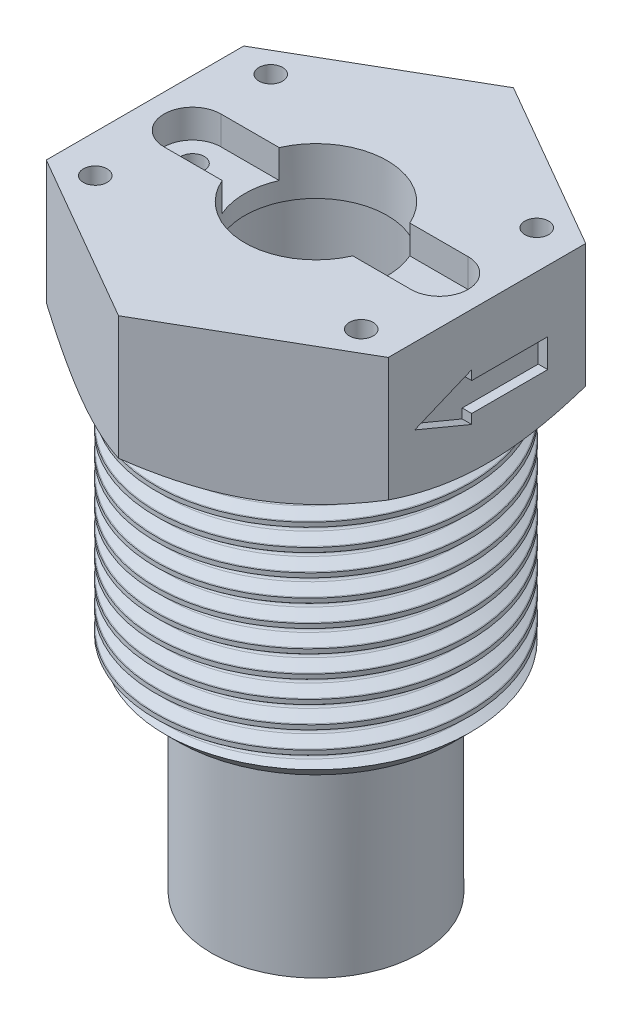
from build123d import *

# Parameters (mm, degrees)
SKETCH_1_W             = 11
SKETCH_1_H             = 65
SKETCH_8_R             = 18.027171515
CUT_EXTRUDE_8_DEPTH    = 2
SKETCH_10_R            = 9.5
CUT_EXTRUDE_10_DEPTH   = 58
SKETCH_11_R            = 7.5
CUT_EXTRUDE_11_DEPTH   = 6
SKETCH_25_R            = 9.5
EXTRUDE_4_DEPTH        = 15
WRAP_START             = -33
WRAP_1_DEPTH           = 1
SKETCH_20_R            = 16.5
SKETCH_20_R_2          = 11
EXTRUDE_3_DEPTH        = 27
CHAMFER_1_SIZE         = 2
SWEEP_2_PITCH          = 2.309
CUT_EXTRUDE_12_DEPTH   = 3
HOLE_WIZARD_M3_1_D     = 2.5
HOLE_WIZARD_M3_1_DEPTH = 10.5
HOLE_WIZARD_M3_1_TIP   = 0.751075774


with BuildPart() as part:
    # 草图1 → 旋转1 (revolve)
    with BuildSketch(Plane.XY, mode=Mode.PRIVATE) as revolve_1_sk:
        with Locations((5.5, 32.5)):
            Rectangle(SKETCH_1_W, SKETCH_1_H)
    revolve(revolve_1_sk.sketch.rotate(Axis((0, 65, 0), (0, -1, 0)), 180), axis=Axis((0, 65, 0), (0, -1, 0)))

    # 草图8 → 切除-拉伸8 (cut)
    with BuildSketch(Plane.XZ):
        Circle(SKETCH_8_R)
    extrude(amount=-CUT_EXTRUDE_8_DEPTH, mode=Mode.SUBTRACT)

    # 草图10 → 切除-拉伸10 (cut)
    with BuildSketch(Plane.XZ.offset(-2)):
        Circle(SKETCH_10_R)
    extrude(amount=-CUT_EXTRUDE_10_DEPTH, mode=Mode.SUBTRACT)

    # 草图11 → 切除-拉伸11 (cut)
    with BuildSketch(Plane(origin=(0, 65, 0), x_dir=(1, 0, 0), z_dir=(0, 1, 0))):
        with Locations(Location((0, 0, 0), (0, 0, 180))):
            Circle(SKETCH_11_R)
    extrude(amount=-CUT_EXTRUDE_11_DEPTH, mode=Mode.SUBTRACT)

    # 草图25 → 凸台-拉伸4 (add)
    with BuildSketch(Plane(origin=(0, 50, 0), x_dir=(1, 0, 0), z_dir=(0, 1, 0))):
        Polygon((0, 20.784609691), (-18, 10.392304845), (-18, -10.392304845), (0, -20.784609691), (18, -10.392304845), (18, 10.392304845), align=None)
        Circle(SKETCH_25_R, mode=Mode.SUBTRACT)
    extrude(amount=EXTRUDE_4_DEPTH)

    # 包覆1: read off the stored shape, not the designer's step
    # 包覆1 outline → 包覆1 (cut)
    with BuildSketch(Plane(origin=(50, 0, 0), x_dir=(0, 0, -1), z_dir=(1, 0, 0)).offset(WRAP_START)):
        Polygon((-7.607695155, 57), (-1.607695155, 54.5), (-1.607695155, 55.5), (6.392304845, 55.5), (6.392304845, 58.5), (-1.607695155, 58.5), (-1.607695155, 59.5), align=None)
    wrap_1 = extrude(amount=WRAP_1_DEPTH, mode=Mode.SUBTRACT)

    # 镜向1: 包覆1 across plane
    add(wrap_1.mirror(Plane(origin=(0, 0, 0), x_dir=(0, 0, 1), z_dir=(1, 0, 0))), mode=Mode.SUBTRACT)

    # 草图20 → 凸台-拉伸3 (add)
    with BuildSketch(Plane(origin=(0, 50, 0), x_dir=(1, 0, 0), z_dir=(0, 1, 0))):
        with Locations(Location((0, 0, 0), (0, 0, 270))):
            Circle(SKETCH_20_R)
        with Locations(Location((0, 0, 0), (0, 0, 270))):
            Circle(SKETCH_20_R_2, mode=Mode.SUBTRACT)
    extrude(amount=-EXTRUDE_3_DEPTH)

    # 草图21 → 切除-旋转2 (revolve, cut)
    with BuildSketch(Plane(origin=(0, 0, 0), x_dir=(0, 0, -1), z_dir=(1, 0, 0)), mode=Mode.PRIVATE) as cut_revolve_2_sk:
        Polygon((20.784609691, 52), (20.784609691, 50), (17.784609691, 50), align=None)
    revolve(cut_revolve_2_sk.sketch.rotate(Axis((0, 52, 0), (0, 1, 0)), 180), axis=Axis((0, 52, 0), (0, 1, 0)), mode=Mode.SUBTRACT)

    # 倒角1
    chamfer_1_edges = [part.edges().sort_by_distance(p)[0] for p in [
        (0, 23, -16.5),
    ]]
    chamfer(chamfer_1_edges, length=CHAMFER_1_SIZE)

    # 切除-扫描2: arcs per turn and ends read off the stored shape
    # 切除-扫描2: the profile of 草图24 screwed along a right-hand helix through 12 turns, 10 arcs to a turn; built about Z, then put on its axis
    sweep_2_z = Axis((0, 0, 0), (0, 0, 1))
    sweep_2_corners = [(16.42937431, 0, -0.590182434), (15.292853797, 0, -1.181817566), (15.122228107, 0, -1.463), (15.292853797, 0, -1.744182434), (16.42937431, 0, -2.335817566), (16.6, 0, -2.617), (16.6, 0, -0.309)]
    with BuildLine(mode=Mode.PRIVATE) as sweep_2_profile:
        Line(sweep_2_corners[0], sweep_2_corners[1])
        Line(sweep_2_corners[3], sweep_2_corners[4])
        Line(sweep_2_corners[5], sweep_2_corners[6])
        ThreePointArc((15.292853797, 0, -1.181817566), (15.168221044, 0, -1.298548877), (15.122228107, 0, -1.463))
        ThreePointArc((15.122228107, 0, -1.463), (15.168221044, 0, -1.627451123), (15.292853797, 0, -1.744182434))
        ThreePointArc((16.42937431, 0, -2.335817566), (16.554007063, 0, -2.452548877), (16.6, 0, -2.617))
        ThreePointArc((16.6, 0, -0.309), (16.554007063, 0, -0.473451123), (16.42937431, 0, -0.590182434))
    sweep_2_cap = Face(sweep_2_profile.wire())
    sweep_2_arcs = [((15.292853797, 0, -1.181817566), (15.122228107, 0, -1.270639678), (15.122228107, 0, -1.463), (1, 0.854911870672946, 1)), ((15.122228107, 0, -1.463), (15.122228107, 0, -1.655360322), (15.292853797, 0, -1.744182434), (1, 0.854911870672946, 1)), ((16.42937431, 0, -2.335817566), (16.6, 0, -2.424639678), (16.6, 0, -2.617), (1, 0.8549118706729456, 1)), ((16.6, 0, -0.309), (16.6, 0, -0.501360322), (16.42937431, 0, -0.590182434), (1, 0.8549118706729619, 1))]  # start, shoulder, end, weights
    sweep_2_turn_angles = [0, 18, 36, 54, 72, 90, 108, 126, 144, 162, 180, 198, 216, 234, 252, 270, 288, 306, 324, 342, 360]
    sweep_2_turn_weights = [1, 0.9510565162951535, 1, 0.9510565162951535, 1, 0.9510565162951535, 1, 0.9510565162951535, 1, 0.9510565162951535, 1, 0.9510565162951535, 1, 0.9510565162951535, 1, 0.9510565162951535, 1, 0.9510565162951535, 1, 0.9510565162951535, 1]
    sweep_2_turn_rails = [Edge.make_bspline([Vector(p[0], p[1], 0).rotate(sweep_2_z, sweep_2_turn_angles[k]) / sweep_2_turn_weights[k] + Vector(0, 0, p[2] + SWEEP_2_PITCH * sweep_2_turn_angles[k] / 360) for k in range(21)], [0, 0, 0, 1, 1, 2, 2, 3, 3, 4, 4, 5, 5, 6, 6, 7, 7, 8, 8, 9, 9, 10, 10, 10], 2, sweep_2_turn_weights) for p in sweep_2_corners]
    sweep_2_turn_sides = [*[Face.make_surface_from_curves(sweep_2_turn_rails[p[0]], sweep_2_turn_rails[p[1]]) for p in [(0, 1), (3, 4), (5, 6)]], *[Face.make_bezier_surface([[Vector(p[j][0], p[j][1], 0).rotate(sweep_2_z, sweep_2_turn_angles[2 * i + k]) / sweep_2_turn_weights[2 * i + k] + Vector(0, 0, p[j][2] + SWEEP_2_PITCH * sweep_2_turn_angles[2 * i + k] / 360) for k in range(3)] for j in range(3)], [[p[3][j] * sweep_2_turn_weights[2 * i + k] for k in range(3)] for j in range(3)]) for p in sweep_2_arcs for i in range(10)]]
    sweep_2 = Plane(origin=(0, 23, 0), x_dir=(0, 0, -1), z_dir=(0, 1, 0)) * Solid(Shell([*[p.moved(Location((0, 0, SWEEP_2_PITCH * i))) for i in range(12) for p in sweep_2_turn_sides], sweep_2_cap, sweep_2_cap.rotate(sweep_2_z, 4320).moved(Location((0, 0, SWEEP_2_PITCH * 4320 / 360)))]))
    add(sweep_2, mode=Mode.SUBTRACT)

    # 草图27 → 切除-拉伸12 (cut)
    with BuildSketch(Plane(origin=(0, 65, 0), x_dir=(1, 0, 0), z_dir=(0, 1, 0))):
        with BuildLine():
            Line((-13, 3), (13, 3))
            ThreePointArc((13, 3), (16, 0), (13, -3))
            Line((13, -3), (-13, -3))
            ThreePointArc((-13, -3), (-16, 0), (-13, 3))
        make_face()
    extrude(amount=-CUT_EXTRUDE_12_DEPTH, mode=Mode.SUBTRACT)

    # M3 螺纹孔1
    with Locations(Plane(origin=(0, 65, 0), x_dir=(1, 0, 0), z_dir=(0, 1, 0))):
        with Locations((-14, 9.237604307), (-14, -9.237604307), (14, -9.237604307), (14, 9.237604307), (-13, 0), (13, 0)):
            Hole(HOLE_WIZARD_M3_1_D / 2, depth=HOLE_WIZARD_M3_1_DEPTH)
            with Locations((0, 0, -(HOLE_WIZARD_M3_1_DEPTH + HOLE_WIZARD_M3_1_TIP / 2))):  # 118° drill point
                Cone(0, HOLE_WIZARD_M3_1_D / 2, HOLE_WIZARD_M3_1_TIP, mode=Mode.SUBTRACT)


solid = part.part
